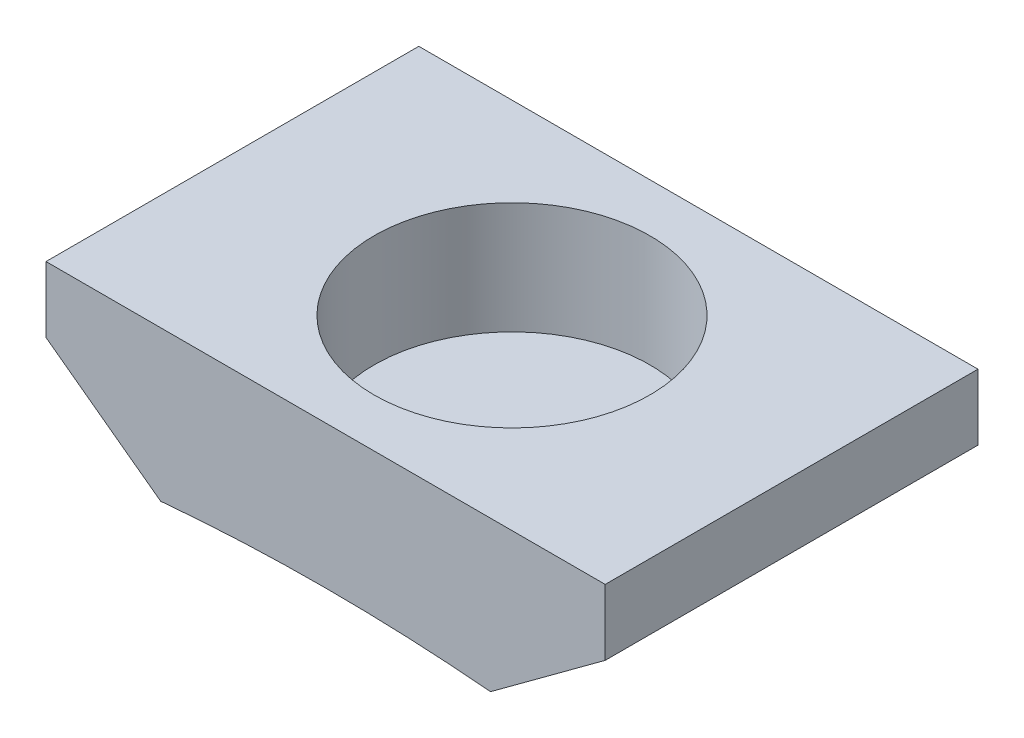
from build123d import *

# Parameters (mm, degrees)
SKETCH1_W           = 15
SKETCH1_H           = 10
BOSS_EXTRUDE1_DEPTH = 1.4
SKETCH2_W           = 15
SKETCH2_H           = 10
SKETCH2_R           = 3.7
BOSS_EXTRUDE2_DEPTH = 3
CUT_EXTRUDE2_DEPTH  = 14.251792332
CHAMFER1_SIZE       = 2.634615696


with BuildPart() as part:
    # Sketch1 → Boss-Extrude1 (new body)
    with BuildSketch(Plane(origin=(0, 0, 0), x_dir=(1, 0, 0), z_dir=(0, 1, 0))):
        Rectangle(SKETCH1_W, SKETCH1_H)
    extrude(amount=BOSS_EXTRUDE1_DEPTH)

    # Sketch2 → Boss-Extrude2 (add)
    with BuildSketch(Plane(origin=(0, 1.4, 0), x_dir=(1, 0, 0), z_dir=(0, 1, 0))):
        Rectangle(SKETCH2_W, SKETCH2_H)
        with Locations(Location((0, 0, 0), (0, 0, 270))):
            Circle(SKETCH2_R, mode=Mode.SUBTRACT)
    extrude(amount=BOSS_EXTRUDE2_DEPTH)

    # Sketch5 → Cut-Extrude2 (cut, through all)
    with BuildSketch(Plane(origin=(0, 0, -5), x_dir=(-1, 0, 0), z_dir=(0, 0, -1))):
        with BuildLine():
            Line((7.5, 0), (-7.5, 0))
            ThreePointArc((-7.5, 0), (0, 0.565700167), (7.5, 0))
        make_face()
    extrude(amount=-CUT_EXTRUDE2_DEPTH, mode=Mode.SUBTRACT)

    # Chamfer1
    # the kernel refuses this chamfer: 3, 2.634615696 mm, written as the material it takes off along each edge
    with BuildSketch(Plane(origin=(7.5, 0, -12.964818141), x_dir=(-0.9928577476807653, 0.11930420307046066, 0), z_dir=(0, 0, 1)), Plane(origin=(-7.5, 0, 12.964818141), x_dir=(0.9928577476807653, 0.1193042030704611, 0), z_dir=(0, 0, -1))) as chamfer1_piece_1:
        with BuildLine():
            Line((3.097426723, 0), (CHAMFER1_SIZE * 0.119304203085, -CHAMFER1_SIZE * 0.992857747804))
            Line((CHAMFER1_SIZE * 0.119304203085, -CHAMFER1_SIZE * 0.992857747804), (0, 0))
            ThreePointArc((0, 0), (1.592490504, -0.023971722), (3.097426723, 0))
        make_face()
    extrude(amount=25.929636281, mode=Mode.SUBTRACT)


solid = part.part
